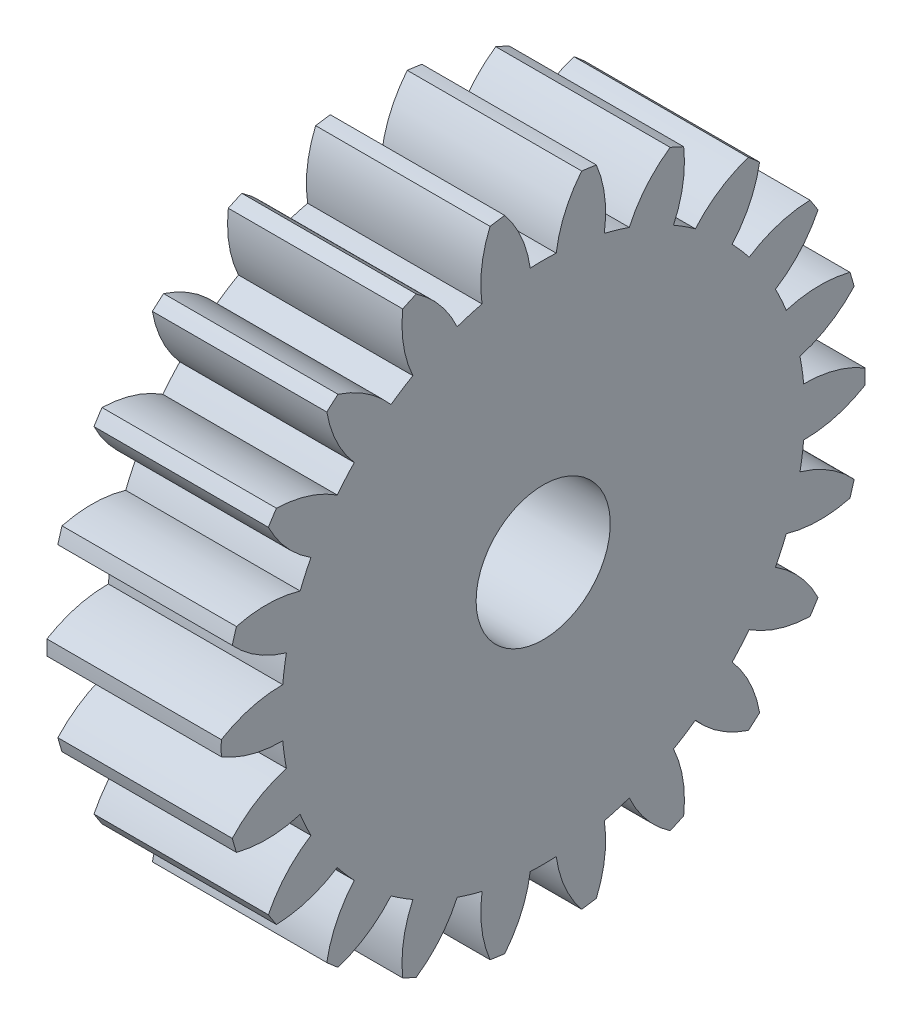
from build123d import *

# Parameters (mm, degrees)
BASPROSKE_W      = 13
BASPROSKE_H      = 24
TOOTHCUT_DEPTH   = 37.345563691
TEETHCUTS_COUNT  = 22
TEETHCUTS_ANGLE  = 343.636363636
HUBNEAONESKE_R   = 6
HUBNEARONE_DEPTH = 4.0000508
BORSKE_R         = 5
BORE_DEPTH       = 17.0000508
SCALE1_SCALE     = 0.317565217


with BuildPart() as part:
    # BasProSke → Base-Revolve (revolve)
    with BuildSketch(Plane(origin=(0, 0, 0), x_dir=(1, 0, 0), z_dir=(0, 1, 0))):
        with Locations((6.5, 12)):
            Rectangle(BASPROSKE_W, BASPROSKE_H)
    revolve(axis=Axis((-10, 0, 0), (1, 0, 0)))

    # TooCutSke → ToothCut (cut, through all)
    with BuildSketch(Plane(origin=(0, 0, 0), x_dir=(0, 0, -1), z_dir=(1, 0, 0))):
        with BuildLine():
            ThreePointArc((0.968170358, 19.474949221), (0, 19.499), (-0.968170358, 19.474949221))
            ThreePointArc((-0.968170358, 19.474949221), (-1.624144469, 21.795843598), (-2.885568663, 23.851485041))
            ThreePointArc((-2.885568663, 23.851485041), (0, 24.0254), (2.885568663, 23.851485041))
            ThreePointArc((2.885568663, 23.851485041), (1.624144469, 21.795843598), (0.968170358, 19.474949221))
        make_face()
    toothcut = extrude(amount=TOOTHCUT_DEPTH, mode=Mode.SUBTRACT)

    # TeethCuts: ToothCut ×22 about axis
    teethcuts_axis = Axis((-10, 0, 0), (1, 0, 0))
    for i in range(1, TEETHCUTS_COUNT):
        add(toothcut.rotate(teethcuts_axis, i * TEETHCUTS_ANGLE / (TEETHCUTS_COUNT - 1)), mode=Mode.SUBTRACT)

    # HubNeaOneSke → HubNearOne (add)
    with BuildSketch(Plane.ZY):
        Circle(HUBNEAONESKE_R)
    extrude(amount=HUBNEARONE_DEPTH)

    # BorSke → Bore (cut, symmetric)
    with BuildSketch(Plane(origin=(0, 0, 0), x_dir=(0, 0, -1), z_dir=(1, 0, 0))):
        Circle(BORSKE_R)
    extrude(amount=BORE_DEPTH, both=True, mode=Mode.SUBTRACT)


with BuildPart() as part_1:
    # Scale1: scaled about (6.435728892, 0, 0)
    add(part.part.scale(SCALE1_SCALE).moved(Location((4.39196525, 0, 0))))


solid = part_1.part
